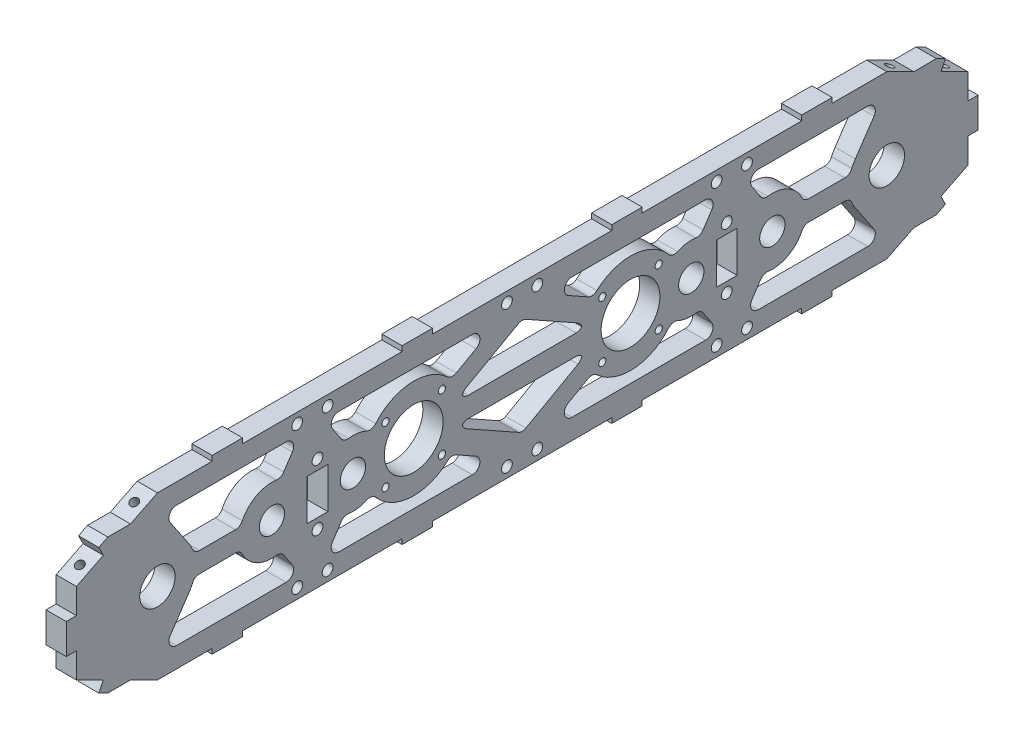
from build123d import *

# Parameters (mm, degrees)
SKETCH1_R                   = 7.9375
SKETCH1_R_2                 = 11.1125
BOSS_EXTRUDE1_DEPTH         = 12.7
F_8_CLEARANCE_HOLE1_D       = 4.4958
SKETCH5_R                   = 18.415
CUT_EXTRUDE1_DEPTH          = 218.842023092
CUT_EXTRUDE3_DEPTH          = 218.842023092
BOSS_EXTRUDE2_DEPTH         = 12.7
CUT_EXTRUDE4_DEPTH          = 218.842023092
BOSS_EXTRUDE3_DEPTH         = 12.7
CUT_EXTRUDE5_DEPTH          = 352.269809441
FILLET1_R                   = 4.7625
SKETCH14_W                  = 12.954
SKETCH14_H                  = 25.654
SKETCH14_W_2                = 12.7
SKETCH14_H_2                = 25.4
CUT_EXTRUDE6_DEPTH          = 352.269809441
F_1_4_CLEARANCE_HOLE1_D     = 6.7564
F_1_4_CLEARANCE_HOLE2_D     = 6.7564
SKETCH19_W                  = 19.05
SKETCH19_H                  = 3.175
BOSS_EXTRUDE4_DEPTH         = 12.7
SKETCH20_W                  = 6.35
SKETCH20_H                  = 19.05
BOSS_EXTRUDE5_DEPTH         = 12.7
F_1_4_20_TAPPED_HOLE1_D     = 5.1054
F_1_4_20_TAPPED_HOLE1_DEPTH = 22.86
F_1_4_20_TAPPED_HOLE1_TIP   = 1.533816902
F_1_4_20_TAPPED_HOLE2_D     = 5.1054
F_1_4_20_TAPPED_HOLE2_DEPTH = 22.86
F_1_4_20_TAPPED_HOLE2_TIP   = 1.533816902
F_1_4_20_TAPPED_HOLE3_D     = 5.1054
F_1_4_20_TAPPED_HOLE3_DEPTH = 22.86
F_1_4_20_TAPPED_HOLE3_TIP   = 1.533816902
F_1_4_20_TAPPED_HOLE4_D     = 5.1054
F_1_4_20_TAPPED_HOLE4_DEPTH = 22.86
F_1_4_20_TAPPED_HOLE4_TIP   = 1.533816902


with BuildPart() as part:
    # Sketch1 → Boss-Extrude1 (new body)
    with BuildSketch(Plane(origin=(0, 0, 0), x_dir=(0, 0, -1), z_dir=(1, 0, 0))):
        with BuildLine():
            Line((93.345, 0), (55.245, 50.8))
            Line((55.245, 50.8), (-160.655, 50.8))
            ThreePointArc((-160.655, 50.8), (-211.455, 0), (-160.655, -50.8))
            Line((-160.655, -50.8), (55.245, -50.8))
            Line((55.245, -50.8), (93.345, 0))
        make_face()
        with Locations((-88.9, 0)):
            Circle(SKETCH1_R, mode=Mode.SUBTRACT)
        with Locations((-38.1, 0)):
            Circle(SKETCH1_R, mode=Mode.SUBTRACT)
        with Locations((-160.655, 0)):
            Circle(SKETCH1_R_2, mode=Mode.SUBTRACT)
        Circle(SKETCH1_R, mode=Mode.SUBTRACT)
    boss_extrude1 = extrude(amount=BOSS_EXTRUDE1_DEPTH)

    # #8 Clearance Hole1 (through all)
    with Locations(Plane.ZY):
        with Locations((-17.691104559, 17.691104559), (17.691104559, 17.691104559), (17.691104559, -17.691104559), (-17.691104559, -17.691104559)):
            f_8_clearance_hole1 = Hole(F_8_CLEARANCE_HOLE1_D / 2)

    # Sketch5 → Cut-Extrude1 (cut, through all)
    with BuildSketch(Plane.ZY):
        Circle(SKETCH5_R)
    cut_extrude1 = extrude(amount=-CUT_EXTRUDE1_DEPTH, mode=Mode.SUBTRACT)

    # Sketch8 → Cut-Extrude3 (cut, through all)
    with BuildSketch(Plane(origin=(12.7, 0, 0), x_dir=(0, 0, -1), z_dir=(1, 0, 0))):
        Polygon((-160.655, 50.8), (-211.455, 25.4), (-211.455, -25.4), (-160.655, -50.8), (-233.239745749, -50.8), (-233.239745749, 50.8), align=None)
    cut_extrude3 = extrude(amount=-CUT_EXTRUDE3_DEPTH, mode=Mode.SUBTRACT)

    # Sketch9 → Boss-Extrude2 (add)
    with BuildSketch(Plane(origin=(12.7, 0, 0), x_dir=(0, 0, -1), z_dir=(1, 0, 0))):
        Polygon((-160.655, 50.8), (-211.455, 25.4), (-211.455, 0), (-211.455, -25.4), (-160.655, -50.8), (-160.655, -40.64), (-202.749323348, 0), (-160.655, 40.64), align=None)
    boss_extrude2 = extrude(amount=-BOSS_EXTRUDE2_DEPTH)

    # Sketch10 → Cut-Extrude4 (cut, through all)
    with BuildSketch(Plane.ZY):
        Polygon((-67.945, -33.866666667), (-67.945, 33.866666667), (-93.345, 0), align=None)
    extrude(amount=-CUT_EXTRUDE4_DEPTH, mode=Mode.SUBTRACT)

    # Mirror2: Boss-Extrude1 across plane
    add(boss_extrude1.mirror(Plane(origin=(12.7, -33.866666667, -67.945), x_dir=(1, 0, 0), z_dir=(0, 0, 1))))

    # Sketch11 → Boss-Extrude3 (add)
    with BuildSketch(Plane(origin=(12.7, 0, 0), x_dir=(0, 0, -1), z_dir=(1, 0, 0))):
        Polygon((55.245, 50.8), (67.945, 33.866666667), (67.945, 50.8), align=None)
        Polygon((67.945, -33.866666667), (55.245, -50.8), (67.945, -50.8), align=None)
    boss_extrude3 = extrude(amount=-BOSS_EXTRUDE3_DEPTH)

    # Mirror6: #8 Clearance Hole1, Cut-Extrude1, Cut-Extrude3, Boss-Extrude2, Boss-Extrude3 across plane
    add(f_8_clearance_hole1.mirror(Plane(origin=(-21.166666667, 33.866666667, -67.945), x_dir=(1, 0, 0), z_dir=(0, 0, -1))), mode=Mode.SUBTRACT)
    add(cut_extrude1.mirror(Plane(origin=(-21.166666667, 33.866666667, -67.945), x_dir=(1, 0, 0), z_dir=(0, 0, -1))), mode=Mode.SUBTRACT)
    add(cut_extrude3.mirror(Plane(origin=(-21.166666667, 33.866666667, -67.945), x_dir=(1, 0, 0), z_dir=(0, 0, -1))), mode=Mode.SUBTRACT)
    add(boss_extrude2.mirror(Plane(origin=(-21.166666667, 33.866666667, -67.945), x_dir=(1, 0, 0), z_dir=(0, 0, -1))))
    add(boss_extrude3.mirror(Plane(origin=(-21.166666667, 33.866666667, -67.945), x_dir=(1, 0, 0), z_dir=(0, 0, -1))))

    # Sketch12 → Cut-Extrude5 (cut, through all)
    with BuildSketch(Plane(origin=(12.7, 0, 0), x_dir=(0, 0, -1), z_dir=(1, 0, 0))):
        with BuildLine():
            Line((-137.704778732, 6.35), (-108.536290542, 6.35))
            ThreePointArc((-108.536290542, 6.35), (-98.637967938, 18.195559532), (-83.291265152, 19.860727571))
            Line((-83.291265152, 19.860727571), (-71.1317502, 38.1))
            Line((-71.1317502, 38.1), (-157.656936686, 38.1))
            Line((-157.656936686, 38.1), (-140.923230859, 13.330132889))
            ThreePointArc((-140.923230859, 13.330132889), (-139.030508327, 9.970783126), (-137.704778732, 6.35))
        make_face()
        with BuildLine():
            ThreePointArc((-83.291265152, -19.860727571), (-98.637967938, -18.195559532), (-108.536290542, -6.35))
            Line((-108.536290542, -6.35), (-137.704778732, -6.35))
            ThreePointArc((-137.704778732, -6.35), (-139.030508327, -9.970783126), (-140.923230859, -13.330132889))
            Line((-140.923230859, -13.330132889), (-157.656936686, -38.1))
            Line((-157.656936686, -38.1), (-71.1317502, -38.1))
            Line((-71.1317502, -38.1), (-83.291265152, -19.860727571))
        make_face()
        with BuildLine():
            Line((54.961962963, 38.1), (-55.8682498, 38.1))
            Line((-55.8682498, 38.1), (-43.708734848, 19.860727571))
            ThreePointArc((-43.708734848, 19.860727571), (-34.594569537, 20.337609582), (-26.16596875, 16.837021838))
            ThreePointArc((-26.16596875, 16.837021838), (-2.25093926, 31.033473822), (23.462408065, 20.436698188))
            Line((23.462408065, 20.436698188), (54.961962963, 38.1))
        make_face()
        with BuildLine():
            Line((-43.708734848, -19.860727571), (-55.8682498, -38.1))
            Line((-55.8682498, -38.1), (54.961962963, -38.1))
            Line((54.961962963, -38.1), (23.462408065, -20.436698188))
            ThreePointArc((23.462408065, -20.436698188), (-2.25093926, -31.033473822), (-26.16596875, -16.837021838))
            ThreePointArc((-26.16596875, -16.837021838), (-34.594569537, -20.337609582), (-43.708734848, -19.860727571))
        make_face()
        with BuildLine():
            Line((67.945, 30.819792316), (29.673974724, 9.359404311))
            ThreePointArc((29.673974724, 9.359404311), (30.104690021, 7.864532011), (30.460149786, 6.35))
            Line((30.460149786, 6.35), (105.429850214, 6.35))
            ThreePointArc((105.429850214, 6.35), (105.785309979, 7.864532011), (106.216025276, 9.359404311))
            Line((106.216025276, 9.359404311), (67.945, 30.819792316))
        make_face()
        with BuildLine():
            Line((67.945, -30.819792316), (106.216025276, -9.359404311))
            ThreePointArc((106.216025276, -9.359404311), (105.785309979, -7.864532011), (105.429850214, -6.35))
            Line((105.429850214, -6.35), (30.460149786, -6.35))
            ThreePointArc((30.460149786, -6.35), (30.104690021, -7.864532011), (29.673974724, -9.359404311))
            Line((29.673974724, -9.359404311), (67.945, -30.819792316))
        make_face()
        with BuildLine():
            Line((191.7582498, 38.1), (80.928037037, 38.1))
            Line((80.928037037, 38.1), (112.427591935, 20.436698188))
            ThreePointArc((112.427591935, 20.436698188), (138.14093926, 31.033473822), (162.05596875, 16.837021838))
            ThreePointArc((162.05596875, 16.837021838), (170.484569537, 20.337609582), (179.598734848, 19.860727571))
            Line((179.598734848, 19.860727571), (191.7582498, 38.1))
        make_face()
        with BuildLine():
            Line((112.427591935, -20.436698188), (80.928037037, -38.1))
            Line((80.928037037, -38.1), (191.7582498, -38.1))
            Line((191.7582498, -38.1), (179.598734848, -19.860727571))
            ThreePointArc((179.598734848, -19.860727571), (170.484569537, -20.337609582), (162.05596875, -16.837021838))
            ThreePointArc((162.05596875, -16.837021838), (138.14093926, -31.033473822), (112.427591935, -20.436698188))
        make_face()
        with BuildLine():
            Line((293.546936686, 38.1), (207.0217502, 38.1))
            Line((207.0217502, 38.1), (219.181265152, 19.860727571))
            ThreePointArc((219.181265152, 19.860727571), (234.527967938, 18.195559532), (244.426290542, 6.35))
            Line((244.426290542, 6.35), (273.594778732, 6.35))
            ThreePointArc((273.594778732, 6.35), (274.920508327, 9.970783126), (276.813230859, 13.330132889))
            Line((276.813230859, 13.330132889), (293.546936686, 38.1))
        make_face()
        with BuildLine():
            Line((219.181265152, -19.860727571), (207.0217502, -38.1))
            Line((207.0217502, -38.1), (293.546936686, -38.1))
            Line((293.546936686, -38.1), (276.813230859, -13.330132889))
            ThreePointArc((276.813230859, -13.330132889), (274.920508327, -9.970783126), (273.594778732, -6.35))
            Line((273.594778732, -6.35), (244.426290542, -6.35))
            ThreePointArc((244.426290542, -6.35), (234.527967938, -18.195559532), (219.181265152, -19.860727571))
        make_face()
    extrude(amount=-CUT_EXTRUDE5_DEPTH, mode=Mode.SUBTRACT)

    # Fillet1
    # the kernel refuses this fillet: 4.7625 mm, written as the material it adds along each edge
    with BuildSketch(Plane(origin=(12.7, 19.860727571, 83.291265152), x_dir=(0, 0.2037736835935473, 0.9790180212206091), z_dir=(-1, 0, 0)), Plane(origin=(12.7, -6.35, 108.536290542), x_dir=(0, -0.927625534993526, -0.3735115350668232), z_dir=(-1, 0, 0)), Plane(origin=(12.7, -19.860727571, 43.708734848), x_dir=(0, -0.20377368359354983, -0.9790180212206085), z_dir=(-1, 0, 0)), Plane(origin=(12.7, 19.860727571, -179.598734848), x_dir=(0, 0.20377368359354847, 0.9790180212206089), z_dir=(-1, 0, 0)), Plane(origin=(12.7, 6.35, -244.426290542), x_dir=(0, 0.9276255349935313, 0.37351153506680995), z_dir=(-1, 0, 0))) as fillet1_piece_1:
        with BuildLine():
            CenterArc((3.221139031, 4.750828331), FILLET1_R, 201.932346456, 64.055520228)
            Line((-1.196677579, 2.971979645), (0, 0))
            ThreePointArc((0, 0), (1.443958876, 0.050577233), (2.887917752, 0))
        make_face()
    extrude(amount=12.7)
    with BuildSketch(Plane(origin=(12.7, 6.35, 108.536290542), x_dir=(0, 0, 1), z_dir=(-1, 0, 0)), Plane(origin=(12.7, 19.860727571, 43.708734848), x_dir=(0, 0.8320502943378215, 0.5547001962252625), z_dir=(-1, 0, 0)), Plane(origin=(12.7, -19.860727571, -179.598734848), x_dir=(0, -0.8320502943378191, -0.554700196225266), z_dir=(-1, 0, 0)), Plane(origin=(12.7, 19.860727571, -219.181265152), x_dir=(0, 0.8320502943378228, 0.5547001962252603), z_dir=(-1, 0, 0)), Plane(origin=(12.7, -6.35, -244.426290542), x_dir=(0, 0, -1), z_dir=(-1, 0, 0))) as fillet1_piece_2:
        with BuildLine():
            CenterArc((3.203857088, 4.7625), FILLET1_R, 205.944479772, 64.055520228)
            ThreePointArc((-1.078670593, 2.67890625), (-0.492418564, 1.358344305), (0, 0))
            Line((0, 0), (3.203857088, 0))
        make_face()
    extrude(amount=12.7)
    with BuildSketch(Plane(origin=(12.7, 6.35, 137.704778732), x_dir=(0, 0, -1), z_dir=(-1, 0, 0))) as fillet1_piece_3:
        with BuildLine():
            CenterArc((3.375488005, -4.7625), FILLET1_R, 90, 67.114619524)
            ThreePointArc((-1.012130207, -2.910416667), (-0.458939018, -1.471596961), (0, 0))
            Line((0, 0), (3.375488005, 0))
        make_face()
    extrude(amount=12.7)
    with BuildSketch(Plane(origin=(12.7, 38.1, 157.656936686), x_dir=(0, 0, -1), z_dir=(-1, 0, 0)), Plane(origin=(12.7, -38.1, 157.656936686), x_dir=(0, 0.8286307250625837, -0.5597956068800977), z_dir=(-1, 0, 0)), Plane(origin=(12.7, 38.1, -293.546936686), x_dir=(0, -0.8286307250625813, 0.559795606880101), z_dir=(-1, 0, 0)), Plane(origin=(12.7, -38.1, -293.546936686), x_dir=(0, 0, 1), z_dir=(-1, 0, 0))) as fillet1_piece_4:
        with BuildLine():
            CenterArc((FILLET1_R * 1.88237722752, FILLET1_R), FILLET1_R, 145.958336224, 124.041663776)
            Line((FILLET1_R * 1.05374650246, FILLET1_R * 1.55979560688), (0, 0))
            Line((0, 0), (FILLET1_R * 1.88237722752, 0))
        make_face()
    extrude(amount=12.7)
    with BuildSketch(Plane(origin=(12.7, 38.1, 71.1317502), x_dir=(0, -0.8320502943378454, 0.5547001962252265), z_dir=(-1, 0, 0)), Plane(origin=(12.7, -38.1, 71.1317502), x_dir=(0, 0, 1), z_dir=(-1, 0, 0)), Plane(origin=(12.7, 38.1, 55.8682498), x_dir=(0, 0, -1), z_dir=(-1, 0, 0)), Plane(origin=(12.7, -38.1, 55.8682498), x_dir=(0, 0.8320502943378442, -0.5547001962252284), z_dir=(-1, 0, 0)), Plane(origin=(12.7, 38.1, -191.7582498), x_dir=(0, -0.8320502943378438, 0.5547001962252287), z_dir=(-1, 0, 0)), Plane(origin=(12.7, -38.1, -191.7582498), x_dir=(0, 0, 1), z_dir=(-1, 0, 0)), Plane(origin=(12.7, 38.1, -207.0217502), x_dir=(0, 0, -1), z_dir=(-1, 0, 0)), Plane(origin=(12.7, -38.1, -207.0217502), x_dir=(0, 0.8320502943378442, -0.5547001962252284), z_dir=(-1, 0, 0))) as fillet1_piece_5:
        with BuildLine():
            CenterArc((FILLET1_R * 1.86851709182, FILLET1_R), FILLET1_R, 146.309932474, 123.690067526)
            Line((FILLET1_R * 1.03646679748, FILLET1_R * 1.55470019623), (0, 0))
            Line((0, 0), (FILLET1_R * 1.86851709182, 0))
        make_face()
    extrude(amount=12.7)
    with BuildSketch(Plane(origin=(12.7, -19.860727571, 83.291265152), x_dir=(0, -0.20377368359354944, 0.9790180212206085), z_dir=(-1, 0, 0))) as fillet1_piece_6:
        with BuildLine():
            CenterArc((3.221139031, -4.750828331), FILLET1_R, 94.012133316, 64.055520228)
            Line((-1.196677579, -2.971979645), (0, 0))
            ThreePointArc((0, 0), (1.443958876, -0.050577233), (2.887917752, 0))
        make_face()
    extrude(amount=12.7)
    with BuildSketch(Plane(origin=(12.7, -6.35, 137.704778732), x_dir=(0, 0, -1), z_dir=(-1, 0, 0)), Plane(origin=(12.7, 6.35, -273.594778732), x_dir=(0, 0, 1), z_dir=(-1, 0, 0))) as fillet1_piece_7:
        with BuildLine():
            CenterArc((3.375488005, 4.7625), FILLET1_R, 202.885380476, 67.114619524)
            ThreePointArc((-1.012130207, 2.910416667), (-0.458939018, 1.471596961), (0, 0))
            Line((0, 0), (3.375488005, 0))
        make_face()
    extrude(amount=12.7)
    with BuildSketch(Plane(origin=(12.7, 20.436698188, -23.462408065), x_dir=(0, 0.4890997369942295, -0.8722278643062118), z_dir=(-1, 0, 0)), Plane(origin=(12.7, 9.359404311, -106.216025276), x_dir=(0, 0.4890997369940977, 0.8722278643062857), z_dir=(-1, 0, 0)), Plane(origin=(12.7, -9.359404311, -29.673974724), x_dir=(0, -0.4890997369940977, -0.8722278643062857), z_dir=(-1, 0, 0)), Plane(origin=(12.7, -20.436698188, -112.427591935), x_dir=(0, -0.4890997369942295, 0.8722278643062118), z_dir=(-1, 0, 0))) as fillet1_piece_8:
        with BuildLine():
            CenterArc((3.653005301, -4.7625), FILLET1_R, 90, 71.956768238)
            ThreePointArc((-0.875289622, -3.287389381), (-0.392683361, -1.65566598), (0, 0))
            Line((0, 0), (3.653005301, 0))
        make_face()
    extrude(amount=12.7)
    with BuildSketch(Plane(origin=(12.7, 16.837021838, 26.16596875), x_dir=(0, 0.5004157897773664, 0.8657852143236765), z_dir=(-1, 0, 0)), Plane(origin=(12.7, -16.837021838, -162.05596875), x_dir=(0, -0.5004157897773296, -0.8657852143236978), z_dir=(-1, 0, 0))) as fillet1_piece_9:
        with BuildLine():
            CenterArc((4.253622344, 4.742128208), FILLET1_R, 189.992615807, 74.705995035)
            ThreePointArc((-0.436631124, 3.915733228), (-0.156273589, 1.964784719), (0, 0))
            ThreePointArc((0, 0), (1.906796223, 0.088277766), (3.813592446, 0))
        make_face()
    extrude(amount=12.7)
    with BuildSketch(Plane(origin=(12.7, 38.1, -54.961962963), x_dir=(0, -0.48909973699416215, 0.8722278643062498), z_dir=(-1, 0, 0)), Plane(origin=(12.7, -38.1, -54.961962963), x_dir=(0, 0, 1), z_dir=(-1, 0, 0)), Plane(origin=(12.7, 38.1, -80.928037037), x_dir=(0, 0, -1), z_dir=(-1, 0, 0)), Plane(origin=(12.7, -38.1, -80.928037037), x_dir=(0, 0.4890997369941626, -0.8722278643062494), z_dir=(-1, 0, 0))) as fillet1_piece_10:
        with BuildLine():
            CenterArc((FILLET1_R * 3.82790609501, FILLET1_R), FILLET1_R, 119.281427061, 150.718572939)
            Line((FILLET1_R * 3.33880635801, FILLET1_R * 1.87222786431), (0, 0))
            Line((0, 0), (FILLET1_R * 3.82790609501, 0))
        make_face()
    extrude(amount=12.7)
    with BuildSketch(Plane(origin=(12.7, -16.837021838, 26.16596875), x_dir=(0, -0.8049963069263687, -0.5932798208559834), z_dir=(-1, 0, 0)), Plane(origin=(12.7, 16.837021838, -162.05596875), x_dir=(0, 0.804996306926335, 0.5932798208560291), z_dir=(-1, 0, 0))) as fillet1_piece_11:
        with BuildLine():
            CenterArc((4.241532449, 4.752944925), FILLET1_R, 191.66397825, 74.705995035)
            ThreePointArc((-0.422622445, 3.790102586), (-0.123577204, 1.904834238), (0, 0))
            ThreePointArc((0, 0), (1.970000853, 0.062426489), (3.940001707, 0))
        make_face()
    extrude(amount=12.7)
    with BuildSketch(Plane(origin=(12.7, -20.436698188, -23.462408065), x_dir=(0, -0.7170211441342242, 0.6970514176618882), z_dir=(-1, 0, 0)), Plane(origin=(12.7, 20.436698188, -112.427591935), x_dir=(0, 0.7170211441342186, -0.697051417661894), z_dir=(-1, 0, 0))) as fillet1_piece_12:
        with BuildLine():
            CenterArc((3.662271206, -4.755378386), FILLET1_R, 93.133743888, 71.956768238)
            Line((-0.939892022, -3.530021348), (0, 0))
            ThreePointArc((0, 0), (1.700960086, -0.046527881), (3.401920173, 0))
        make_face()
    extrude(amount=12.7)
    with BuildSketch(Plane(origin=(12.7, 6.35, -105.429850214), x_dir=(0, 0, 1), z_dir=(-1, 0, 0)), Plane(origin=(12.7, 9.359404311, -29.673974724), x_dir=(0, 0.4890997369941012, -0.8722278643062839), z_dir=(-1, 0, 0)), Plane(origin=(12.7, -9.359404311, -106.216025276), x_dir=(0, -0.4890997369941018, 0.8722278643062835), z_dir=(-1, 0, 0)), Plane(origin=(12.7, -6.35, -30.460149786), x_dir=(0, 0, -1), z_dir=(-1, 0, 0))) as fillet1_piece_13:
        with BuildLine():
            CenterArc((3.653005301, 4.7625), FILLET1_R, 198.043231762, 71.956768238)
            ThreePointArc((-0.875289622, 3.287389381), (-0.392683361, 1.65566598), (0, 0))
            Line((0, 0), (3.653005301, 0))
        make_face()
    extrude(amount=12.7)
    with BuildSketch(Plane(origin=(12.7, 6.35, -30.460149786), x_dir=(0, 0.9663334862604559, 0.2572928163235678), z_dir=(-1, 0, 0)), Plane(origin=(12.7, -6.35, -105.429850214), x_dir=(0, -0.9663334862604682, -0.2572928163235219), z_dir=(-1, 0, 0))) as fillet1_piece_14:
        with BuildLine():
            CenterArc((3.662271206, 4.755378386), FILLET1_R, 194.909487874, 71.956768238)
            Line((-0.939892022, 3.530021348), (0, 0))
            ThreePointArc((0, 0), (1.700960086, 0.046527881), (3.401920173, 0))
        make_face()
    extrude(amount=12.7)
    with BuildSketch(Plane(origin=(12.7, 30.819792316, -67.945), x_dir=(0, -0.4890997369941593, -0.8722278643062512), z_dir=(-1, 0, 0)), Plane(origin=(12.7, -30.819792316, -67.945), x_dir=(0, 0.48909973699415826, 0.8722278643062518), z_dir=(-1, 0, 0))) as fillet1_piece_15:
        with BuildLine():
            CenterArc((FILLET1_R * 0.560747663551, FILLET1_R), FILLET1_R, 211.437145878, 58.562854122)
            Line((-FILLET1_R * 0.292465174511, FILLET1_R * 0.478437105456), (0, 0))
            Line((0, 0), (FILLET1_R * 0.560747663551, 0))
        make_face()
    extrude(amount=12.7)
    with BuildSketch(Plane(origin=(12.7, -6.35, -273.594778732), x_dir=(0, -0.9445157900124606, -0.3284660140975585), z_dir=(-1, 0, 0))) as fillet1_piece_16:
        with BuildLine():
            CenterArc((3.389523359, 4.752521112), FILLET1_R, 199.175695215, 67.114619524)
            Line((-1.108733091, 3.18820172), (0, 0))
            ThreePointArc((0, 0), (1.540692436, 0.049894439), (3.081384872, 0))
        make_face()
    extrude(amount=12.7)
    with BuildSketch(Plane(origin=(12.7, -19.860727571, -219.181265152), x_dir=(0, -0.8320502943378228, 0.5547001962252603), z_dir=(-1, 0, 0))) as fillet1_piece_17:
        with BuildLine():
            CenterArc((3.203857088, -4.7625), FILLET1_R, 90, 64.055520228)
            ThreePointArc((-1.078670593, -2.67890625), (-0.492418564, -1.358344305), (0, 0))
            Line((0, 0), (3.203857088, 0))
        make_face()
    extrude(amount=12.7)

    # Sketch14 → Cut-Extrude6 (cut, through all)
    # profile 1 of 2: a face of its own
    with BuildSketch(Plane(origin=(12.7, 0, 0), x_dir=(0, 0, -1), z_dir=(1, 0, 0))):
        with Locations((-60.325, 0)):
            Rectangle(SKETCH14_W, SKETCH14_H)
        with Locations((-60.325, 0)):
            Rectangle(SKETCH14_W_2, SKETCH14_H_2, mode=Mode.SUBTRACT)
    # profile 2 of 2: a face of its own
    with BuildSketch(Plane(origin=(12.7, 0, 0), x_dir=(0, 0, -1), z_dir=(1, 0, 0))):
        with Locations((196.215, 0)):
            Rectangle(SKETCH14_W, SKETCH14_H)
        with Locations((196.215, 0)):
            Rectangle(SKETCH14_W_2, SKETCH14_H_2, mode=Mode.SUBTRACT)
    extrude(amount=-CUT_EXTRUDE6_DEPTH, mode=Mode.SUBTRACT)


with BuildPart() as body_2:
    # of the pieces the cut leaves, the one that is kept (cut_extrude6_keep)
    add(part.part.solids().sort_by_distance((12.7, -22.526497804, -217.404084997))[0])

    # 1/4 Clearance Hole1 (through all)
    with Locations(Plane(origin=(12.7, 0, 0), x_dir=(0, 0, -1), z_dir=(1, 0, 0))):
        with Locations((-60.325, 19.05), (-60.325, -19.05), (196.215, -19.05), (196.215, 19.05)):
            Hole(F_1_4_CLEARANCE_HOLE1_D / 2)

    # 1/4 Clearance Hole2 (through all)
    with Locations(Plane(origin=(12.7, 0, 0), x_dir=(0, 0, -1), z_dir=(1, 0, 0))):
        with Locations((-73.025, 44.45), (-53.975, 44.45), (58.42, 44.45), (77.47, 44.45), (189.865, 44.45), (208.915, 44.45)):
            f_1_4_clearance_hole2 = Hole(F_1_4_CLEARANCE_HOLE2_D / 2)

    # Sketch19 → Boss-Extrude4 (add)
    with BuildSketch(Plane(origin=(12.7, 0, 0), x_dir=(0, 0, -1), z_dir=(1, 0, 0))):
        with Locations((-116.84, 52.3875)):
            Rectangle(SKETCH19_W, SKETCH19_H)
        with Locations((2.2225, 52.3875)):
            Rectangle(SKETCH19_W, SKETCH19_H)
        with Locations((133.6675, 52.3875)):
            Rectangle(SKETCH19_W, SKETCH19_H)
        with Locations((252.73, 52.3875)):
            Rectangle(SKETCH19_W, SKETCH19_H)
    boss_extrude4 = extrude(amount=-BOSS_EXTRUDE4_DEPTH)

    # Mirror7: 1/4 Clearance Hole2, Boss-Extrude4 across plane
    add(f_1_4_clearance_hole2.mirror(Plane.ZX), mode=Mode.SUBTRACT)
    add(boss_extrude4.mirror(Plane.ZX))

    # Sketch20 → Boss-Extrude5 (add)
    with BuildSketch(Plane(origin=(12.7, 0, 0), x_dir=(0, 0, -1), z_dir=(1, 0, 0))):
        Polygon((-194.574418994, 33.840290503), (-177.535581006, 42.359709497), (-191.734612663, 42.359709497), (-197.414225326, 39.519903166), align=None)
        with Locations((-214.63, 0)):
            Rectangle(SKETCH20_W, SKETCH20_H)
        Polygon((-191.734612663, -42.359709497), (-177.535581006, -42.359709497), (-194.574418994, -33.840290503), (-197.414225326, -39.519903166), align=None)
        Polygon((333.304225326, -39.519903166), (330.464418994, -33.840290503), (313.425581006, -42.359709497), (327.624612663, -42.359709497), align=None)
        with Locations((350.52, 0)):
            Rectangle(SKETCH20_W, SKETCH20_H)
        Polygon((327.624612663, 42.359709497), (313.425581006, 42.359709497), (330.464418994, 33.840290503), (333.304225326, 39.519903166), align=None)
    extrude(amount=-BOSS_EXTRUDE5_DEPTH)

    # 1/4-20 Tapped Hole1
    with Locations(Plane(origin=(0, 104.902, 52.451), x_dir=(1, 0, 0), z_dir=(0, 0.8944271909999159, 0.447213595499958))):
        with Locations((6.35, -130.146876347), (6.35, -168.246876347)):
            Hole(F_1_4_20_TAPPED_HOLE1_D / 2, depth=F_1_4_20_TAPPED_HOLE1_DEPTH)
            with Locations((0, 0, -(F_1_4_20_TAPPED_HOLE1_DEPTH + F_1_4_20_TAPPED_HOLE1_TIP / 2))):  # 118° drill point
                Cone(0, F_1_4_20_TAPPED_HOLE1_D / 2, F_1_4_20_TAPPED_HOLE1_TIP, mode=Mode.SUBTRACT)

    # 1/4-20 Tapped Hole2
    with Locations(Plane(origin=(0, -104.902, 52.451), x_dir=(-1, 0, 0), z_dir=(0, -0.8944271909999159, 0.447213595499958))):
        with Locations((-6.35, -168.246876347), (-6.35, -130.146876347)):
            Hole(F_1_4_20_TAPPED_HOLE2_D / 2, depth=F_1_4_20_TAPPED_HOLE2_DEPTH)
            with Locations((0, 0, -(F_1_4_20_TAPPED_HOLE2_DEPTH + F_1_4_20_TAPPED_HOLE2_TIP / 2))):  # 118° drill point
                Cone(0, F_1_4_20_TAPPED_HOLE2_D / 2, F_1_4_20_TAPPED_HOLE2_TIP, mode=Mode.SUBTRACT)

    # 1/4-20 Tapped Hole3
    with Locations(Plane(origin=(0, 159.258, -79.629), x_dir=(1, 0, 0), z_dir=(0, 0.8944271909999159, -0.4472135954999583))):
        with Locations((6.35, 251.690587332), (6.35, 289.790587332)):
            Hole(F_1_4_20_TAPPED_HOLE3_D / 2, depth=F_1_4_20_TAPPED_HOLE3_DEPTH)
            with Locations((0, 0, -(F_1_4_20_TAPPED_HOLE3_DEPTH + F_1_4_20_TAPPED_HOLE3_TIP / 2))):  # 118° drill point
                Cone(0, F_1_4_20_TAPPED_HOLE3_D / 2, F_1_4_20_TAPPED_HOLE3_TIP, mode=Mode.SUBTRACT)

    # 1/4-20 Tapped Hole4
    with Locations(Plane(origin=(0, -159.258, -79.629), x_dir=(-1, 0, 0), z_dir=(0, -0.8944271909999159, -0.4472135954999583))):
        with Locations((-6.35, 289.790587332), (-6.35, 251.690587332)):
            Hole(F_1_4_20_TAPPED_HOLE4_D / 2, depth=F_1_4_20_TAPPED_HOLE4_DEPTH)
            with Locations((0, 0, -(F_1_4_20_TAPPED_HOLE4_DEPTH + F_1_4_20_TAPPED_HOLE4_TIP / 2))):  # 118° drill point
                Cone(0, F_1_4_20_TAPPED_HOLE4_D / 2, F_1_4_20_TAPPED_HOLE4_TIP, mode=Mode.SUBTRACT)


solid = body_2.part
